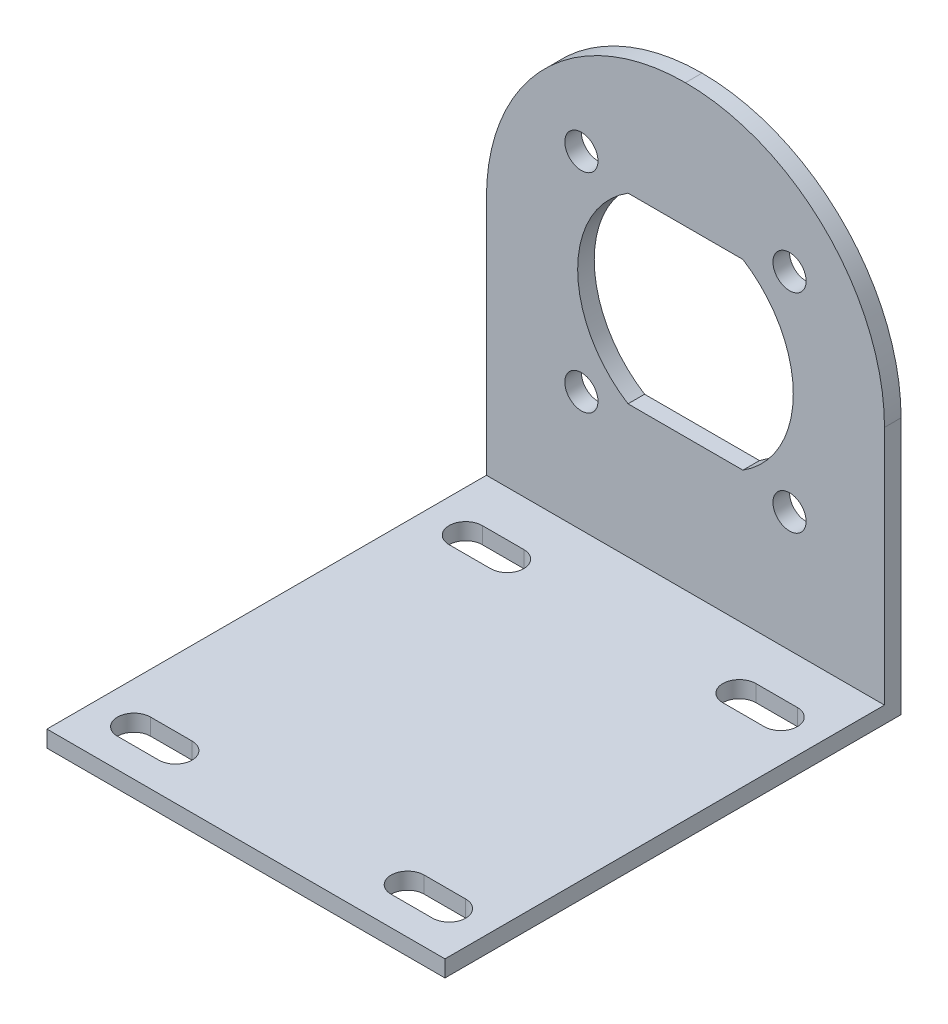
from build123d import *

# Parameters (mm, degrees)
SKETCH2_W           = 50
SKETCH2_H           = 52
BOSS_EXTRUDE1_DEPTH = 52
SKETCH3_W           = 50
SKETCH3_H           = 50
CUT_EXTRUDE1_DEPTH  = 50
CUT_EXTRUDE3_DEPTH  = 50
SKETCH5_R           = 2
CUT_EXTRUDE4_DEPTH  = 50
SKETCH7_W           = 52
SKETCH7_H           = 2
BOSS_EXTRUDE2_DEPTH = 5
SKETCH8_R           = 2.5
CUT_EXTRUDE6_DEPTH  = 5
SKETCH10_W          = 1
SKETCH10_H          = 2
CUT_EXTRUDE7_DEPTH  = 160
SKETCH11_W          = 48
SKETCH11_H          = 2
BOSS_EXTRUDE3_DEPTH = 3
SKETCH12_W          = 48
SKETCH12_H          = 2
BOSS_EXTRUDE4_DEPTH = 53
CUT_EXTRUDE9_DEPTH  = 53
FILLET1_R           = 24
FILLET2_R           = 24


with BuildPart() as part:
    # Sketch2 → Boss-Extrude1 (new body)
    with BuildSketch(Plane(origin=(0, 0, 0), x_dir=(1, 0, 0), z_dir=(0, 1, 0))):
        Rectangle(SKETCH2_W, SKETCH2_H)
    extrude(amount=BOSS_EXTRUDE1_DEPTH)

    # Sketch3 → Cut-Extrude1 (cut)
    with BuildSketch(Plane(origin=(0, 52, 0), x_dir=(1, 0, 0), z_dir=(0, 1, 0))):
        with Locations((0, -1)):
            Rectangle(SKETCH3_W, SKETCH3_H)
    extrude(amount=-CUT_EXTRUDE1_DEPTH, mode=Mode.SUBTRACT)

    # Sketch4 → Cut-Extrude3 (cut)
    with BuildSketch(Plane.XY.offset(-24)):
        with BuildLine():
            Line((-6.92820323, 18), (0, 18))
            Line((0, 18), (0, 24))
            ThreePointArc((0, 24), (-5, 29), (0, 34))
            Line((0, 34), (0, 40))
            Line((0, 40), (-6.92820323, 40))
            ThreePointArc((-6.92820323, 40), (-13, 29), (-6.92820323, 18))
        make_face()
        with BuildLine():
            Line((0, 24), (0, 18))
            Line((0, 18), (6.92820323, 18))
            ThreePointArc((6.92820323, 18), (13, 29), (6.92820323, 40))
            Line((6.92820323, 40), (0, 40))
            Line((0, 40), (0, 34))
            ThreePointArc((0, 34), (3.535533906, 32.535533906), (5, 29))
            ThreePointArc((5, 29), (3.535533906, 25.464466094), (0, 24))
        make_face()
    extrude(amount=-CUT_EXTRUDE3_DEPTH, mode=Mode.SUBTRACT)


with BuildPart() as body_2:
    # of the pieces the cut leaves, the one that is kept (cut_extrude3_keep)
    add(part.part.solids().sort_by_distance((25, 0, 26))[0])

    # Sketch5 → Cut-Extrude4 (cut)
    with BuildSketch(Plane.XY.offset(-24)):
        with Locations((12.55, 41.55)):
            Circle(SKETCH5_R)
        with Locations((-12.55, 41.55)):
            Circle(SKETCH5_R)
        with Locations((12.55, 16.45)):
            Circle(SKETCH5_R)
        with Locations((-12.55, 16.45)):
            Circle(SKETCH5_R)
    extrude(amount=-CUT_EXTRUDE4_DEPTH, mode=Mode.SUBTRACT)

    # Sketch7 → Boss-Extrude2 (add)
    with BuildSketch(Plane(origin=(25, 0, 0), x_dir=(0, 0, -1), z_dir=(1, 0, 0))):
        with Locations((0, 1)):
            Rectangle(SKETCH7_W, SKETCH7_H)
    boss_extrude2 = extrude(amount=BOSS_EXTRUDE2_DEPTH)

    # Mirror1: Boss-Extrude2 across plane
    add(boss_extrude2.mirror(Plane(origin=(0, 0, 0), x_dir=(0, 0, 1), z_dir=(1, 0, 0))))

    # Sketch8 → Cut-Extrude6 (cut)
    with BuildSketch(Plane(origin=(0, 2, 0), x_dir=(1, 0, 0), z_dir=(0, 1, 0))):
        with Locations(Location((-26.5, 14, 0), (0, 0, 270))):
            Circle(SKETCH8_R)
        with Locations(Location((-26.5, -16, 0), (0, 0, 270))):
            Circle(SKETCH8_R)
        with Locations(Location((26.5, 14, 0), (0, 0, 270))):
            Circle(SKETCH8_R)
        with Locations(Location((26.5, -16, 0), (0, 0, 270))):
            Circle(SKETCH8_R)
    extrude(amount=-CUT_EXTRUDE6_DEPTH, mode=Mode.SUBTRACT)

    # Sketch10 → Cut-Extrude7 (cut)
    with BuildSketch(Plane(origin=(0, 52, 0), x_dir=(1, 0, 0), z_dir=(0, 1, 0))):
        Polygon((25, 24), (24, 24), (-24, 24), (-25, 24), (-25, 26), (-30, 26), (-30, -26), (30, -26), (30, 26), (25, 26), align=None)
        with Locations((-24.5, 25)):
            Rectangle(SKETCH10_W, SKETCH10_H)
        with Locations((24.5, 25)):
            Rectangle(SKETCH10_W, SKETCH10_H)
    extrude(amount=-CUT_EXTRUDE7_DEPTH, mode=Mode.SUBTRACT)

    # Sketch11 → Boss-Extrude3 (add)
    with BuildSketch(Plane(origin=(0, 52, 0), x_dir=(1, 0, 0), z_dir=(0, 1, 0))):
        with Locations((0, 25)):
            Rectangle(SKETCH11_W, SKETCH11_H)
    extrude(amount=BOSS_EXTRUDE3_DEPTH)

    # Sketch12 → Boss-Extrude4 (add)
    with BuildSketch(Plane.XY.offset(-24)):
        with Locations((0, 1)):
            Rectangle(SKETCH12_W, SKETCH12_H)
    extrude(amount=BOSS_EXTRUDE4_DEPTH)

    # Sketch13 → Cut-Extrude9 (cut)
    with BuildSketch(Plane(origin=(0, 2, 0), x_dir=(1, 0, 0), z_dir=(0, 1, 0))):
        with BuildLine():
            Line((19, 14.5), (14, 14.5))
            ThreePointArc((14, 14.5), (12, 16.5), (14, 18.5))
            Line((14, 18.5), (19, 18.5))
            ThreePointArc((19, 18.5), (21, 16.5), (19, 14.5))
        make_face()
        with BuildLine():
            Line((-19, 14.5), (-14, 14.5))
            ThreePointArc((-14, 14.5), (-12, 16.5), (-14, 18.5))
            Line((-14, 18.5), (-19, 18.5))
            ThreePointArc((-19, 18.5), (-21, 16.5), (-19, 14.5))
        make_face()
        with BuildLine():
            Line((-19, -21.5), (-14, -21.5))
            ThreePointArc((-14, -21.5), (-12, -23.5), (-14, -25.5))
            Line((-14, -25.5), (-19, -25.5))
            ThreePointArc((-19, -25.5), (-21, -23.5), (-19, -21.5))
        make_face()
        with BuildLine():
            Line((19, -21.5), (14, -21.5))
            ThreePointArc((14, -21.5), (12, -23.5), (14, -25.5))
            Line((14, -25.5), (19, -25.5))
            ThreePointArc((19, -25.5), (21, -23.5), (19, -21.5))
        make_face()
    extrude(amount=-CUT_EXTRUDE9_DEPTH, mode=Mode.SUBTRACT)

    # Fillet1
    fillet1_edges = [body_2.edges().sort_by_distance(p)[0] for p in [
        (-24, 55, -25),
    ]]
    fillet(fillet1_edges, radius=FILLET1_R)

    # Fillet2
    fillet2_edges = [body_2.edges().sort_by_distance(p)[0] for p in [
        (24, 55, -25),
    ]]
    fillet(fillet2_edges, radius=FILLET2_R - 0.0001)  # a hair under: the kernel refuses the full size


solid = body_2.part
